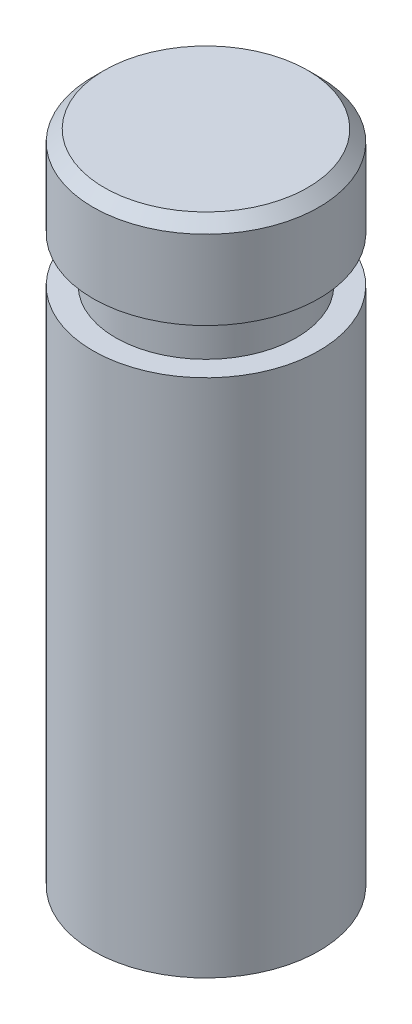
from build123d import *

# Parameters (mm, degrees)
CHANFREIN1_SIZE = 1


with BuildPart() as part:
    # Esquisse1 → Révolution1 (revolve)
    with BuildSketch(Plane.XY):
        Polygon((0, 0), (0, 58), (10, 58), (10, 50), (8, 50), (8, 46), (10, 46), (10, 0), align=None)
    revolve(axis=Axis((0, 63.28317648, 0), (0, -1, 0)))

    # Chanfrein1
    chanfrein1_edges = [part.edges().sort_by_distance(p)[0] for p in [
        (-10, 58, 0),
    ]]
    chamfer(chanfrein1_edges, length=CHANFREIN1_SIZE)


solid = part.part
